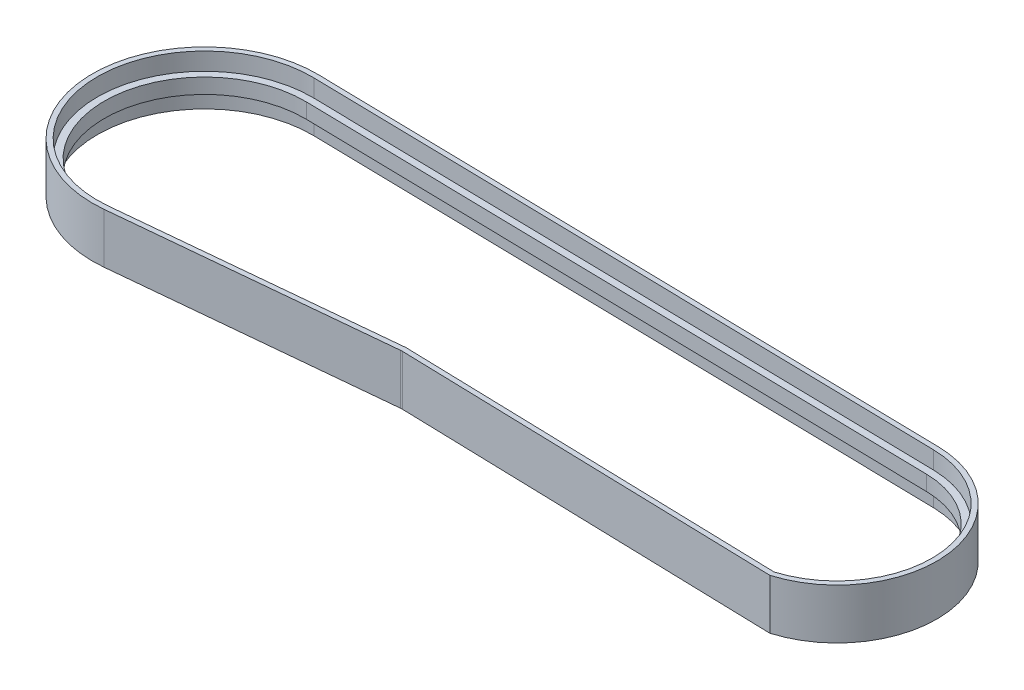
from build123d import *

# Parameters (mm, degrees)
BOSS_EXTRUDE1_DEPTH = 5
BOSS_EXTRUDE2_DEPTH = 1.5


with BuildPart() as part:
    # Sketch1 → Boss-Extrude1 (new, symmetric)
    with BuildSketch(Plane(origin=(0, 0, 0), x_dir=(1, 0, 0), z_dir=(0, 1, 0))):
        with BuildLine():
            Line((0.434583333, 22.345774485), (126.386944444, 19.896237684))
            ThreePointArc((126.386944444, 19.896237684), (145.718371952, 2.682500242), (131.687911153, -19.069810348))
            Line((131.687911153, -19.069810348), (56.476794724, -17.022504579))
            ThreePointArc((56.476794724, -17.022504579), (56.260593188, -17.023299553), (56.044853229, -17.037441902))
            Line((56.044853229, -17.037441902), (2.15009566, -22.24633877))
            ThreePointArc((2.15009566, -22.24633877), (-22.333478961, -0.859195846), (0.434583333, 22.345774485))
        make_face()
        with BuildLine():
            Line((0.415138889, 21.345963546), (126.3675, 18.896426746))
            ThreePointArc((126.3675, 18.896426746), (144.718122582, 2.615700101), (131.533500192, -18.071811631))
            Line((131.533500192, -18.071811631), (56.260793434, -16.022829325))
            ThreePointArc((56.260793434, -16.022829325), (56.104555475, -16.029742245), (55.948652081, -16.042079988))
            Line((55.948652081, -16.042079988), (2.053894512, -21.250976856))
            ThreePointArc((2.053894512, -21.250976856), (-21.334218157, -0.820753078), (0.415138889, 21.345963546))
        make_face(mode=Mode.SUBTRACT)
    extrude(amount=BOSS_EXTRUDE1_DEPTH, both=True)

    # Sketch8 → Boss-Extrude2 (add, symmetric)
    with BuildSketch(Plane(origin=(0, 0, 0), x_dir=(1, 0, 0), z_dir=(0, 1, 0))):
        with BuildLine():
            Line((56.260817447, -16.222904062), (131.560679398, -18.272625554))
            ThreePointArc((131.560679398, -18.272625554), (144.918461076, 2.627133519), (126.371388889, 19.096388933))
            Line((126.371388889, 19.096388933), (0.419027778, 21.545925734))
            ThreePointArc((0.419027778, 21.545925734), (-21.534070318, -0.828441632), (2.073134741, -21.450049239))
            Line((2.073134741, -21.450049239), (55.96789231, -16.241152371))
            ThreePointArc((55.96789231, -16.241152371), (56.114199143, -16.229528317), (56.260817447, -16.222904062))
        make_face()
        with BuildLine():
            Line((56.26361535, -14.622387556), (131.338099627, -16.66597409))
            ThreePointArc((131.338099627, -16.66597409), (143.315684259, 2.533195341), (126.340277778, 17.496691431))
            Line((126.340277778, 17.496691431), (0.387916667, 19.946228231))
            ThreePointArc((0.387916667, 19.946228231), (-19.935253032, -0.766933204), (1.919212904, -19.857470177))
            Line((1.919212904, -19.857470177), (55.813970473, -14.648573309))
            ThreePointArc((55.813970473, -14.648573309), (56.038542943, -14.631188125), (56.26361535, -14.622387556))
        make_face(mode=Mode.SUBTRACT)
    extrude(amount=BOSS_EXTRUDE2_DEPTH, both=True)


solid = part.part
